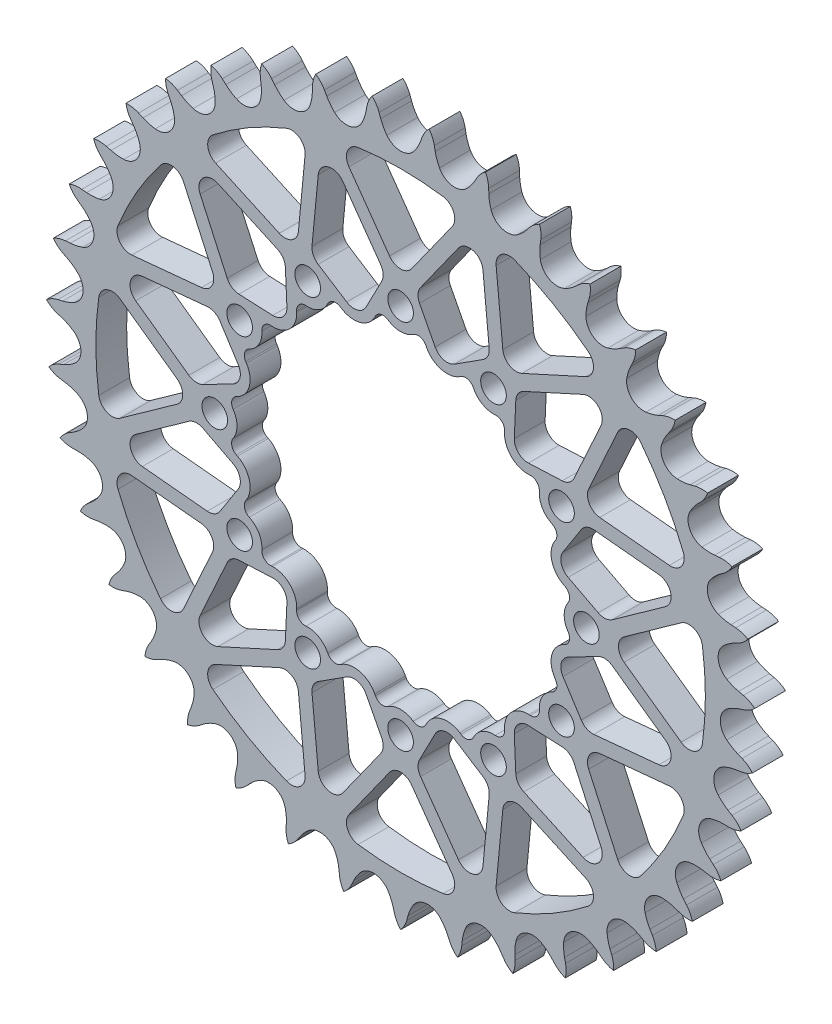
from build123d import *

# Parameters (mm, degrees)
EXTRUSION_DEPTH          = 7.2136
CUT_EXTRUDE_DEPTH        = 118.514389318
CUT_EXTRUDE_DEPTH_BACK   = 118.514389318
SKETCH1_R                = 35.764294032
F_6_0MM_DOWEL_HOLE1_D    = 6
CIRPATTERN1_COUNT        = 12
CUT_EXTRUDE2_DEPTH       = 118.514389318
FILLET2_R                = 3.175
CIRPATTERN3_COUNT        = 12
FILLET2_OF_CIRPATTERN3_R = 3.175
SKETCH14_R               = 35.764294032
CUT_EXTRUDE7_DEPTH       = 118.514389318


with BuildPart() as part:
    # Teeth Sketch → Extrusion (new body)
    with BuildSketch(Plane.XY):
        with BuildLine():
            ThreePointArc((6.676484762, 82.703103732), (5.710873677, 81.555589606), (5.037571935, 80.215493266))
            Line((5.037571935, 80.215493266), (4.65053543, 79.150636707))
            ThreePointArc((4.65053543, 79.150636707), (4.030589042, 77.787636082), (3.22092759, 76.5280518))
            ThreePointArc((3.22092759, 76.5280518), (0, 74.905926143), (-3.22092759, 76.5280518))
            ThreePointArc((-3.22092759, 76.5280518), (-4.030589042, 77.787636082), (-4.65053543, 79.150636707))
            Line((-4.65053543, 79.150636707), (-5.037571935, 80.215493266))
            ThreePointArc((-5.037571935, 80.215493266), (-5.710873677, 81.555589606), (-6.676484762, 82.703103732))
            ThreePointArc((-6.676484762, 82.703103732), (-7.445517227, 81.415554702), (-7.895133318, 79.984807062))
            Line((-7.895133318, 79.984807062), (-8.106342797, 78.871655094))
            ThreePointArc((-8.106342797, 78.871655094), (-8.499620367, 77.426858575), (-9.096745387, 76.053706749))
            ThreePointArc((-9.096745387, 76.053706749), (-12.015755556, 73.935914073), (-15.455180235, 75.020360508))
            ThreePointArc((-15.455180235, 75.020360508), (-16.456408311, 76.133754674), (-17.286967233, 77.379658404))
            Line((-17.286967233, 77.379658404), (-17.83980672, 78.368640329))
            ThreePointArc((-17.83980672, 78.368640329), (-18.719355953, 79.583377579), (-19.856536839, 80.561136787))
            ThreePointArc((-19.856536839, 80.561136787), (-20.409073146, 79.166899696), (-20.623358765, 77.682556369))
            Line((-20.623358765, 77.682556369), (-20.653271004, 76.549939044))
            ThreePointArc((-20.653271004, 76.549939044), (-20.809694072, 75.060766102), (-21.178817437, 73.609610642))
            ThreePointArc((-21.178817437, 73.609610642), (-23.720309356, 71.051000665), (-27.289151829, 71.569681286))
            ThreePointArc((-27.289151829, 71.569681286), (-28.456015249, 72.508049011), (-29.475675664, 73.604587595))
            Line((-29.475675664, 73.604587595), (-30.179999883, 74.492080773))
            ThreePointArc((-30.179999883, 74.492080773), (-31.243016742, 75.549997876), (-32.522315041, 76.332678717))
            ThreePointArc((-32.522315041, 76.332678717), (-32.844044791, 74.867863573), (-32.817450053, 73.368368272))
            Line((-32.817450053, 73.368368272), (-32.66529034, 72.245619783))
            ThreePointArc((-32.66529034, 72.245619783), (-32.580807632, 70.750639215), (-32.71236924, 69.259064285))
            ThreePointArc((-32.71236924, 69.259064285), (-34.810519602, 66.325903661), (-38.416348726, 66.265384911))
            ThreePointArc((-38.416348726, 66.265384911), (-39.71862634, 67.004422965), (-40.900979579, 67.923196629))
            Line((-40.900979579, 67.923196629), (-41.738546902, 68.686215454))
            ThreePointArc((-41.738546902, 68.686215454), (-42.957499809, 69.559912912), (-44.345782367, 70.127244363))
            ThreePointArc((-44.345782367, 70.127244363), (-44.428372928, 68.629789109), (-44.161586623, 67.153977974))
            Line((-44.161586623, 67.153977974), (-43.831295815, 66.070176918))
            ThreePointArc((-43.831295815, 66.070176918), (-43.508095388, 64.608107935), (-43.398687863, 63.114744543))
            ThreePointArc((-43.398687863, 63.114744543), (-44.999155676, 59.883000591), (-48.54858237, 59.244849876))
            ThreePointArc((-48.54858237, 59.244849876), (-49.952545871, 59.765417561), (-51.266969607, 60.48263055))
            Line((-51.266969607, 60.48263055), (-52.21608748, 61.101413234))
            ThreePointArc((-52.21608748, 61.101413234), (-53.559406195, 61.768262742), (-55.020717224, 62.105551216))
            ThreePointArc((-55.020717224, 62.105551216), (-54.862029543, 60.614239157), (-54.361961296, 59.200334922))
            Line((-54.361961296, 59.200334922), (-53.862093752, 58.183551176))
            ThreePointArc((-53.862093752, 58.183551176), (-53.308546327, 56.792260597), (-52.961003266, 55.335786069))
            ThreePointArc((-52.961003266, 55.335786069), (-54.022337255, 51.889159262), (-57.423433231, 50.689904348))
            ThreePointArc((-57.423433231, 50.689904348), (-58.892720703, 50.978519235), (-60.305172051, 51.475596109))
            Line((-60.305172051, 51.475596109), (-61.34125882, 51.934116506))
            ThreePointArc((-61.34125882, 51.934116506), (-62.774152094, 52.376847013), (-64.270644405, 52.475356916))
            ThreePointArc((-64.270644405, 52.475356916), (-63.87478841, 51.02881225), (-63.154389727, 49.713434291))
            Line((-63.154389727, 49.713434291), (-62.497891753, 48.790002021))
            ThreePointArc((-62.497891753, 48.790002021), (-61.728333918, 47.505523541), (-61.151656504, 46.123659804))
            ThreePointArc((-61.151656504, 46.123659804), (-61.646368676, 42.551415963), (-64.811047336, 40.822116924))
            ThreePointArc((-64.811047336, 40.822116924), (-66.307605004, 40.871304038), (-67.781502216, 41.135370767))
            Line((-67.781502216, 41.135370767), (-68.877723777, 41.42175344))
            ThreePointArc((-68.877723777, 41.42175344), (-70.363080428, 41.628898458), (-71.855995657, 41.486078435))
            ThreePointArc((-71.855995657, 41.486078435), (-71.23322381, 40.12176591), (-70.311152637, 38.938981826))
            Line((-70.311152637, 38.938981826), (-69.515027187, 38.132817442))
            ThreePointArc((-69.515027187, 38.132817442), (-68.549390085, 36.988418379), (-67.75851396, 35.716954977))
            ThreePointArc((-67.75851396, 35.716954977), (-67.673791529, 32.111613343), (-70.520089358, 29.897058114))
            ThreePointArc((-70.520089358, 29.897058114), (-72.005157166, 29.705543536), (-73.502327078, 29.729760931))
            Line((-73.502327078, 29.729760931), (-74.630291869, 29.836588719))
            ThreePointArc((-74.630291869, 29.836588719), (-76.129641939, 29.8027833), (-77.580314364, 29.422332315))
            ThreePointArc((-77.580314364, 29.422332315), (-76.74675613, 28.175586908), (-75.646893627, 27.156030185))
            Line((-75.646893627, 27.156030185), (-74.731759931, 26.488012922))
            ThreePointArc((-74.731759931, 26.488012922), (-73.595053056, 25.51333261), (-72.610461496, 24.385199777))
            ThreePointArc((-72.610461496, 24.385199777), (-71.948498729, 20.840136804), (-74.402698108, 18.197681204))
            ThreePointArc((-74.402698108, 18.197681204), (-75.837813579, 17.77042506), (-77.319480277, 17.554165902))
            Line((-77.319480277, 17.554165902), (-78.449974603, 17.478672021))
            ThreePointArc((-78.449974603, 17.478672021), (-79.924485713, 17.204791709), (-81.295343681, 16.596563242))
            ThreePointArc((-81.295343681, 16.596563242), (-80.27258778, 15.499675005), (-79.023419807, 14.669751627))
            Line((-79.023419807, 14.669751627), (-78.012979347, 14.15718278))
            ThreePointArc((-78.012979347, 14.15718278), (-76.734642811, 13.377464928), (-75.58183622, 12.421880712))
            ThreePointArc((-75.58183622, 12.421880712), (-74.359777605, 9.028911669), (-76.358316059, 6.026993909))
            ThreePointArc((-76.358316059, 6.026993909), (-77.706310456, 5.375061909), (-79.134099551, 4.923927198))
            Line((-79.134099551, 4.923927198), (-80.237844202, 4.6680669))
            ThreePointArc((-80.237844202, 4.6680669), (-81.649327289, 4.161205049), (-82.904866299, 3.340951899))
            ThreePointArc((-82.904866299, 3.340951899), (-81.719401571, 2.422329661), (-80.353280924, 1.803534207))
            Line((-80.353280924, 1.803534207), (-79.273703577, 1.45968904))
            ThreePointArc((-79.273703577, 1.45968904), (-77.886845624, 0.895127931), (-76.595681088, 0.136841462))
            ThreePointArc((-76.595681088, 0.136841462), (-74.8451773, -3.016157536), (-76.336293733, -6.299789363))
            ThreePointArc((-76.336293733, -6.299789363), (-77.56225471, -7.159512522), (-78.899187214, -7.833838635))
            Line((-78.899187214, -7.833838635), (-79.947595784, -8.263438702))
            ThreePointArc((-79.947595784, -8.263438702), (-81.259494176, -8.990154635), (-82.367196428, -10.001188343))
            ThreePointArc((-82.367196428, -10.001188343), (-81.049725787, -10.717752749), (-79.602034272, -11.109393802))
            Line((-79.602034272, -11.109393802), (-78.481280524, -11.275609878))
            ThreePointArc((-78.481280524, -11.275609878), (-77.021820047, -11.610392409), (-75.625738049, -12.151741911))
            ThreePointArc((-75.625738049, -12.151741911), (-73.392126218, -14.983109845), (-74.337201497, -18.463411399))
            ThreePointArc((-74.337201497, -18.463411399), (-75.409377308, -19.50865934), (-76.620827372, -20.388712162))
            Line((-76.620827372, -20.388712162), (-77.586746629, -20.980925582))
            ThreePointArc((-77.586746629, -20.980925582), (-78.765082849, -21.908674036), (-79.696259435, -23.08430306))
            ThreePointArc((-79.696259435, -23.08430306), (-78.280904679, -23.580250992), (-76.789136745, -23.734594346))
            Line((-76.789136745, -23.734594346), (-75.656233531, -23.718876424))
            ThreePointArc((-75.656233531, -23.718876424), (-74.161969788, -23.815209685), (-72.697128119, -24.125601551))
            ThreePointArc((-72.697128119, -24.125601551), (-70.038257617, -26.562007479), (-70.41281479, -30.148840778))
            ThreePointArc((-70.41281479, -30.148840778), (-71.303436645, -31.352542128), (-72.358028349, -32.415528753))
            Line((-72.358028349, -32.415528753), (-73.216441492, -33.155017511))
            ThreePointArc((-73.216441492, -33.155017511), (-74.230697248, -34.259770288), (-74.961231185, -35.569546454))
            ThreePointArc((-74.961231185, -35.569546454), (-73.484649258, -35.832033121), (-71.987440912, -35.745081364))
            Line((-71.987440912, -35.745081364), (-70.871729829, -35.547836529))
            ThreePointArc((-70.871729829, -35.547836529), (-69.381363468, -35.403225539), (-67.885700756, -35.474620783))
            ThreePointArc((-67.885700756, -35.474620783), (-64.870434934, -37.452963072), (-64.664773166, -41.053431017))
            ThreePointArc((-64.664773166, -41.053431017), (-65.350774426, -42.384410543), (-66.221194398, -43.602800177))
            Line((-66.221194398, -43.602800177), (-66.949868978, -44.470411902))
            ThreePointArc((-66.949868978, -44.470411902), (-67.773775581, -45.723556485), (-68.284746423, -47.133557278))
            ThreePointArc((-68.284746423, -47.133557278), (-66.785180021, -47.155784414), (-65.321308173, -46.829789551))
            Line((-65.321308173, -46.829789551), (-64.251685552, -46.456126341))
            ThreePointArc((-64.251685552, -46.456126341), (-62.803816278, -46.074316448), (-61.316069403, -45.904865971))
            ThreePointArc((-61.316069403, -45.904865971), (-58.022502061, -47.373906594), (-57.241947884, -50.894758957))
            ThreePointArc((-57.241947884, -50.894758957), (-57.705561477, -52.318544989), (-58.369266298, -53.66078198))
            Line((-58.369266298, -53.66078198), (-58.949330025, -54.634045983))
            ThreePointArc((-58.949330025, -54.634045983), (-59.561548726, -56.003126587), (-59.839722596, -57.476833727))
            ThreePointArc((-59.839722596, -57.476833727), (-58.356009703, -57.25822566), (-56.963387864, -56.701630787))
            Line((-56.963387864, -56.701630787), (-55.967556369, -56.161226883))
            ThreePointArc((-55.967556369, -56.161226883), (-54.599683236, -55.552106762), (-53.15838406, -55.146199243))
            ThreePointArc((-53.15838406, -55.146199243), (-49.671816862, -56.06789082), (-48.336586219, -59.417939375))
            ThreePointArc((-48.336586219, -59.417939375), (-48.565804798, -60.897656602), (-49.00560486, -62.328977716))
            Line((-49.00560486, -62.328977716), (-49.422034389, -63.382686971))
            ThreePointArc((-49.422034389, -63.382686971), (-49.806709045, -64.832245127), (-49.844881387, -66.331490374))
            ThreePointArc((-49.844881387, -66.331490374), (-48.415449386, -65.877708938), (-47.130145731, -65.104929569))
            Line((-47.130145731, -65.104929569), (-46.233896874, -64.411781148))
            ThreePointArc((-46.233896874, -64.411781148), (-44.981447078, -63.591126692), (-43.623924493, -62.959274922))
            ThreePointArc((-43.623924493, -62.959274922), (-40.034657698, -63.309746125), (-38.179332362, -66.402226373))
            ThreePointArc((-38.179332362, -66.402226373), (-38.168219284, -67.899550896), (-38.372723998, -69.38288567))
            Line((-38.372723998, -69.38288567), (-38.614734022, -70.489749661))
            ThreePointArc((-38.614734022, -70.489749661), (-38.761901763, -71.982242573), (-38.559083932, -73.468196262))
            ThreePointArc((-38.559083932, -73.468196262), (-37.220954361, -72.790994159), (-36.076257579, -71.822044874))
            Line((-36.076257579, -71.822044874), (-35.302803736, -70.994104116))
            ThreePointArc((-35.302803736, -70.994104116), (-34.198215068, -69.983169844), (-32.959628196, -69.141738451))
            ThreePointArc((-32.959628196, -69.141738451), (-29.360621929, -68.91191226), (-27.033253851, -71.666730588))
            ThreePointArc((-27.033253851, -71.666730588), (-26.78209694, -73.142882488), (-26.74600974, -74.639813329))
            Line((-26.74600974, -74.639813329), (-26.807332328, -75.77116486))
            ThreePointArc((-26.807332328, -75.77116486), (-26.713181585, -77.267937748), (-26.274626458, -78.702114459))
            ThreePointArc((-26.274626458, -78.702114459), (-25.06245617, -77.819030866), (-24.088013307, -76.679006943))
            Line((-24.088013307, -76.679006943), (-23.457386525, -75.737717079))
            ThreePointArc((-23.457386525, -75.737717079), (-22.529267252, -74.562685657), (-21.441694841, -73.533467273))
            ThreePointArc((-21.441694841, -73.533467273), (-17.926161474, -72.729296065), (-15.187028265, -75.075104125))
            ThreePointArc((-15.187028265, -75.075104125), (-14.702332353, -76.491851845), (-14.426587879, -77.96360903))
            Line((-14.426587879, -77.96360903), (-14.305634807, -79.090146691))
            ThreePointArc((-14.305634807, -79.090146691), (-13.972604036, -80.552433921), (-13.309669959, -81.897689231))
            ThreePointArc((-13.309669959, -81.897689231), (-12.254853529, -80.83159555), (-11.475902142, -79.55002301))
            Line((-11.475902142, -79.55002301), (-11.004435324, -78.519762952))
            ThreePointArc((-11.004435324, -78.519762952), (-10.276823247, -77.211067077), (-9.368432854, -76.020717918))
            ThreePointArc((-9.368432854, -76.020717918), (-6.027422853, -74.663029306), (-2.947466624, -76.5390719))
            ThreePointArc((-2.947466624, -76.5390719), (-2.241785081, -77.859722417), (-1.733524971, -79.26818821))
            Line((-1.733524971, -79.26818821), (-1.43342886, -80.360735266))
            ThreePointArc((-1.43342886, -80.360735266), (-0.870143382, -81.750664368), (0, -82.97215687))
            ThreePointArc((0, -82.97215687), (0.870143382, -81.750664368), (1.43342886, -80.360735266))
            Line((1.43342886, -80.360735266), (1.733524971, -79.26818821))
            ThreePointArc((1.733524971, -79.26818821), (2.241785081, -77.859722417), (2.947466624, -76.5390719))
            ThreePointArc((2.947466624, -76.5390719), (6.027422853, -74.663029306), (9.368432854, -76.020717918))
            ThreePointArc((9.368432854, -76.020717918), (10.276823247, -77.211067077), (11.004435324, -78.519762952))
            Line((11.004435324, -78.519762952), (11.475902142, -79.55002301))
            ThreePointArc((11.475902142, -79.55002301), (12.254853529, -80.83159555), (13.309669959, -81.897689231))
            ThreePointArc((13.309669959, -81.897689231), (13.972604036, -80.552433921), (14.305634807, -79.090146691))
            Line((14.305634807, -79.090146691), (14.426587879, -77.96360903))
            ThreePointArc((14.426587879, -77.96360903), (14.702332353, -76.491851845), (15.187028265, -75.075104125))
            ThreePointArc((15.187028265, -75.075104125), (17.926161474, -72.729296065), (21.441694841, -73.533467273))
            ThreePointArc((21.441694841, -73.533467273), (22.529267252, -74.562685657), (23.457386525, -75.737717079))
            Line((23.457386525, -75.737717079), (24.088013307, -76.679006943))
            ThreePointArc((24.088013307, -76.679006943), (25.06245617, -77.819030866), (26.274626458, -78.702114459))
            ThreePointArc((26.274626458, -78.702114459), (26.713181585, -77.267937748), (26.807332328, -75.77116486))
            Line((26.807332328, -75.77116486), (26.74600974, -74.639813329))
            ThreePointArc((26.74600974, -74.639813329), (26.78209694, -73.142882488), (27.033253851, -71.666730588))
            ThreePointArc((27.033253851, -71.666730588), (29.360621929, -68.91191226), (32.959628196, -69.141738451))
            ThreePointArc((32.959628196, -69.141738451), (34.198215068, -69.983169844), (35.302803736, -70.994104116))
            Line((35.302803736, -70.994104116), (36.076257579, -71.822044874))
            ThreePointArc((36.076257579, -71.822044874), (37.220954361, -72.790994159), (38.559083932, -73.468196262))
            ThreePointArc((38.559083932, -73.468196262), (38.761901763, -71.982242573), (38.614734022, -70.489749661))
            Line((38.614734022, -70.489749661), (38.372723998, -69.38288567))
            ThreePointArc((38.372723998, -69.38288567), (38.168219284, -67.899550896), (38.179332362, -66.402226373))
            ThreePointArc((38.179332362, -66.402226373), (40.034657698, -63.309746125), (43.623924493, -62.959274922))
            ThreePointArc((43.623924493, -62.959274922), (44.981447078, -63.591126692), (46.233896874, -64.411781148))
            Line((46.233896874, -64.411781148), (47.130145731, -65.104929569))
            ThreePointArc((47.130145731, -65.104929569), (48.415449386, -65.877708938), (49.844881387, -66.331490374))
            ThreePointArc((49.844881387, -66.331490374), (49.806709045, -64.832245127), (49.422034389, -63.382686971))
            Line((49.422034389, -63.382686971), (49.00560486, -62.328977716))
            ThreePointArc((49.00560486, -62.328977716), (48.565804798, -60.897656602), (48.336586219, -59.417939375))
            ThreePointArc((48.336586219, -59.417939375), (49.671816862, -56.06789082), (53.15838406, -55.146199243))
            ThreePointArc((53.15838406, -55.146199243), (54.599683236, -55.552106762), (55.967556369, -56.161226883))
            Line((55.967556369, -56.161226883), (56.963387864, -56.701630787))
            ThreePointArc((56.963387864, -56.701630787), (58.356009703, -57.25822566), (59.839722596, -57.476833727))
            ThreePointArc((59.839722596, -57.476833727), (59.561548726, -56.003126587), (58.949330025, -54.634045983))
            Line((58.949330025, -54.634045983), (58.369266298, -53.66078198))
            ThreePointArc((58.369266298, -53.66078198), (57.705561477, -52.318544989), (57.241947884, -50.894758957))
            ThreePointArc((57.241947884, -50.894758957), (58.022502061, -47.373906594), (61.316069403, -45.904865971))
            ThreePointArc((61.316069403, -45.904865971), (62.803816278, -46.074316448), (64.251685552, -46.456126341))
            Line((64.251685552, -46.456126341), (65.321308173, -46.829789551))
            ThreePointArc((65.321308173, -46.829789551), (66.785180021, -47.155784414), (68.284746423, -47.133557278))
            ThreePointArc((68.284746423, -47.133557278), (67.773775581, -45.723556485), (66.949868978, -44.470411902))
            Line((66.949868978, -44.470411902), (66.221194398, -43.602800177))
            ThreePointArc((66.221194398, -43.602800177), (65.350774426, -42.384410543), (64.664773166, -41.053431017))
            ThreePointArc((64.664773166, -41.053431017), (64.870434934, -37.452963072), (67.885700756, -35.474620783))
            ThreePointArc((67.885700756, -35.474620783), (69.381363468, -35.403225539), (70.871729829, -35.547836529))
            Line((70.871729829, -35.547836529), (71.987440912, -35.745081364))
            ThreePointArc((71.987440912, -35.745081364), (73.484649258, -35.832033121), (74.961231185, -35.569546454))
            ThreePointArc((74.961231185, -35.569546454), (74.230697248, -34.259770288), (73.216441492, -33.155017511))
            Line((73.216441492, -33.155017511), (72.358028349, -32.415528753))
            ThreePointArc((72.358028349, -32.415528753), (71.303436645, -31.352542128), (70.41281479, -30.148840778))
            ThreePointArc((70.41281479, -30.148840778), (70.038257617, -26.562007479), (72.697128119, -24.125601551))
            ThreePointArc((72.697128119, -24.125601551), (74.161969788, -23.815209685), (75.656233531, -23.718876424))
            Line((75.656233531, -23.718876424), (76.789136745, -23.734594346))
            ThreePointArc((76.789136745, -23.734594346), (78.280904679, -23.580250992), (79.696259435, -23.08430306))
            ThreePointArc((79.696259435, -23.08430306), (78.765082849, -21.908674036), (77.586746629, -20.980925582))
            Line((77.586746629, -20.980925582), (76.620827372, -20.388712162))
            ThreePointArc((76.620827372, -20.388712162), (75.409377308, -19.50865934), (74.337201497, -18.463411399))
            ThreePointArc((74.337201497, -18.463411399), (73.392126218, -14.983109845), (75.625738049, -12.151741911))
            ThreePointArc((75.625738049, -12.151741911), (77.021820047, -11.610392409), (78.481280524, -11.275609878))
            Line((78.481280524, -11.275609878), (79.602034272, -11.109393802))
            ThreePointArc((79.602034272, -11.109393802), (81.049725787, -10.717752749), (82.367196428, -10.001188343))
            ThreePointArc((82.367196428, -10.001188343), (81.259494176, -8.990154635), (79.947595784, -8.263438702))
            Line((79.947595784, -8.263438702), (78.899187214, -7.833838635))
            ThreePointArc((78.899187214, -7.833838635), (77.56225471, -7.159512522), (76.336293733, -6.299789363))
            ThreePointArc((76.336293733, -6.299789363), (74.8451773, -3.016157536), (76.595681088, 0.136841462))
            ThreePointArc((76.595681088, 0.136841462), (77.886845624, 0.895127931), (79.273703577, 1.45968904))
            Line((79.273703577, 1.45968904), (80.353280924, 1.803534207))
            ThreePointArc((80.353280924, 1.803534207), (81.719401571, 2.422329661), (82.904866299, 3.340951899))
            ThreePointArc((82.904866299, 3.340951899), (81.649327289, 4.161205049), (80.237844202, 4.6680669))
            Line((80.237844202, 4.6680669), (79.134099551, 4.923927198))
            ThreePointArc((79.134099551, 4.923927198), (77.706310456, 5.375061909), (76.358316059, 6.026993909))
            ThreePointArc((76.358316059, 6.026993909), (74.359777605, 9.028911669), (75.58183622, 12.421880712))
            ThreePointArc((75.58183622, 12.421880712), (76.734642811, 13.377464928), (78.012979347, 14.15718278))
            Line((78.012979347, 14.15718278), (79.023419807, 14.669751627))
            ThreePointArc((79.023419807, 14.669751627), (80.27258778, 15.499675005), (81.295343681, 16.596563242))
            ThreePointArc((81.295343681, 16.596563242), (79.924485713, 17.204791709), (78.449974603, 17.478672021))
            Line((78.449974603, 17.478672021), (77.319480277, 17.554165902))
            ThreePointArc((77.319480277, 17.554165902), (75.837813579, 17.77042506), (74.402698108, 18.197681204))
            ThreePointArc((74.402698108, 18.197681204), (71.948498729, 20.840136804), (72.610461496, 24.385199777))
            ThreePointArc((72.610461496, 24.385199777), (73.595053056, 25.51333261), (74.731759931, 26.488012922))
            Line((74.731759931, 26.488012922), (75.646893627, 27.156030185))
            ThreePointArc((75.646893627, 27.156030185), (76.74675613, 28.175586908), (77.580314364, 29.422332315))
            ThreePointArc((77.580314364, 29.422332315), (76.129641939, 29.8027833), (74.630291869, 29.836588719))
            Line((74.630291869, 29.836588719), (73.502327078, 29.729760931))
            ThreePointArc((73.502327078, 29.729760931), (72.005157166, 29.705543536), (70.520089358, 29.897058114))
            ThreePointArc((70.520089358, 29.897058114), (67.673791529, 32.111613343), (67.75851396, 35.716954977))
            ThreePointArc((67.75851396, 35.716954977), (68.549390085, 36.988418379), (69.515027187, 38.132817442))
            Line((69.515027187, 38.132817442), (70.311152637, 38.938981826))
            ThreePointArc((70.311152637, 38.938981826), (71.23322381, 40.12176591), (71.855995657, 41.486078435))
            ThreePointArc((71.855995657, 41.486078435), (70.363080428, 41.628898458), (68.877723777, 41.42175344))
            Line((68.877723777, 41.42175344), (67.781502216, 41.135370767))
            ThreePointArc((67.781502216, 41.135370767), (66.307605004, 40.871304038), (64.811047336, 40.822116924))
            ThreePointArc((64.811047336, 40.822116924), (61.646368676, 42.551415963), (61.151656504, 46.123659804))
            ThreePointArc((61.151656504, 46.123659804), (61.728333918, 47.505523541), (62.497891753, 48.790002021))
            Line((62.497891753, 48.790002021), (63.154389727, 49.713434291))
            ThreePointArc((63.154389727, 49.713434291), (63.87478841, 51.02881225), (64.270644405, 52.475356916))
            ThreePointArc((64.270644405, 52.475356916), (62.774152094, 52.376847013), (61.34125882, 51.934116506))
            Line((61.34125882, 51.934116506), (60.305172051, 51.475596109))
            ThreePointArc((60.305172051, 51.475596109), (58.892720703, 50.978519235), (57.423433231, 50.689904348))
            ThreePointArc((57.423433231, 50.689904348), (54.022337255, 51.889159262), (52.961003266, 55.335786069))
            ThreePointArc((52.961003266, 55.335786069), (53.308546327, 56.792260597), (53.862093752, 58.183551176))
            Line((53.862093752, 58.183551176), (54.361961296, 59.200334922))
            ThreePointArc((54.361961296, 59.200334922), (54.862029543, 60.614239157), (55.020717224, 62.105551216))
            ThreePointArc((55.020717224, 62.105551216), (53.559406195, 61.768262742), (52.21608748, 61.101413234))
            Line((52.21608748, 61.101413234), (51.266969607, 60.48263055))
            ThreePointArc((51.266969607, 60.48263055), (49.952545871, 59.765417561), (48.54858237, 59.244849876))
            ThreePointArc((48.54858237, 59.244849876), (44.999155676, 59.883000591), (43.398687863, 63.114744543))
            ThreePointArc((43.398687863, 63.114744543), (43.508095388, 64.608107935), (43.831295815, 66.070176918))
            Line((43.831295815, 66.070176918), (44.161586623, 67.153977974))
            ThreePointArc((44.161586623, 67.153977974), (44.428372928, 68.629789109), (44.345782367, 70.127244363))
            ThreePointArc((44.345782367, 70.127244363), (42.957499809, 69.559912912), (41.738546902, 68.686215454))
            Line((41.738546902, 68.686215454), (40.900979579, 67.923196629))
            ThreePointArc((40.900979579, 67.923196629), (39.71862634, 67.004422965), (38.416348726, 66.265384911))
            ThreePointArc((38.416348726, 66.265384911), (34.810519602, 66.325903661), (32.71236924, 69.259064285))
            ThreePointArc((32.71236924, 69.259064285), (32.580807632, 70.750639215), (32.66529034, 72.245619783))
            Line((32.66529034, 72.245619783), (32.817450053, 73.368368272))
            ThreePointArc((32.817450053, 73.368368272), (32.844044791, 74.867863573), (32.522315041, 76.332678717))
            ThreePointArc((32.522315041, 76.332678717), (31.243016742, 75.549997876), (30.179999883, 74.492080773))
            Line((30.179999883, 74.492080773), (29.475675664, 73.604587595))
            ThreePointArc((29.475675664, 73.604587595), (28.456015249, 72.508049011), (27.289151829, 71.569681286))
            ThreePointArc((27.289151829, 71.569681286), (23.720309356, 71.051000665), (21.178817437, 73.609610642))
            ThreePointArc((21.178817437, 73.609610642), (20.809694072, 75.060766102), (20.653271004, 76.549939044))
            Line((20.653271004, 76.549939044), (20.623358765, 77.682556369))
            ThreePointArc((20.623358765, 77.682556369), (20.409073146, 79.166899696), (19.856536839, 80.561136787))
            ThreePointArc((19.856536839, 80.561136787), (18.719355953, 79.583377579), (17.83980672, 78.368640329))
            Line((17.83980672, 78.368640329), (17.286967233, 77.379658404))
            ThreePointArc((17.286967233, 77.379658404), (16.456408311, 76.133754674), (15.455180235, 75.020360508))
            ThreePointArc((15.455180235, 75.020360508), (12.015755556, 73.935914073), (9.096745387, 76.053706749))
            ThreePointArc((9.096745387, 76.053706749), (8.499620367, 77.426858575), (8.106342797, 78.871655094))
            Line((8.106342797, 78.871655094), (7.895133318, 79.984807062))
            ThreePointArc((7.895133318, 79.984807062), (7.445517227, 81.415554702), (6.676484762, 82.703103732))
        make_face()
    extrude(amount=EXTRUSION_DEPTH)

    # Sketch1 → Cut-Extrude (cut, two sides: drawn at the far end of the back side and taken through both)
    with BuildSketch(Plane(origin=(0, 0, 0), x_dir=(-1, 0, 0), z_dir=(0, 0, -1)).offset(-CUT_EXTRUDE_DEPTH_BACK)):
        Circle(SKETCH1_R)
    extrude(amount=CUT_EXTRUDE_DEPTH + CUT_EXTRUDE_DEPTH_BACK, mode=Mode.SUBTRACT)

    # Ø6.0mm Dowel Hole1 (through all)
    with Locations(Plane.XY.offset(7.2136)):
        with Locations((-43.500000122, 0)):
            f_6_0mm_dowel_hole1 = Hole(F_6_0MM_DOWEL_HOLE1_D / 2)

    # CirPattern1: Ø6.0mm Dowel Hole1 ×12 about axis
    cirpattern1_axis = Axis((0, 0, 7.2136), (0, 0, -1))
    for i in range(1, CIRPATTERN1_COUNT):
        add(f_6_0mm_dowel_hole1.rotate(cirpattern1_axis, i * 360 / CIRPATTERN1_COUNT), mode=Mode.SUBTRACT)

    # Sketch9 → Cut-Extrude2 (cut, through all)
    with BuildSketch(Plane.XY):
        with BuildLine():
            Line((-48.707000122, 0), (-69.753908506, 15.006805414))
            ThreePointArc((-69.753908506, 15.006805414), (-71.349926143, 0), (-69.753908506, -15.006805414))
            Line((-69.753908506, -15.006805414), (-48.707000122, 0))
        make_face()
        Polygon((-43.325238517, 20.926367996), (-68.918736366, 18.466719753), (-47.983941179, 3.539852965), (-36.140398804, 9.683790674), align=None)
    cut_extrude2 = extrude(amount=CUT_EXTRUDE2_DEPTH, mode=Mode.SUBTRACT)

    # Fillet2
    fillet2_edges = [part.edges().sort_by_distance(p)[0] for p in [
        (-68.918736366, 18.466719753, 3.6068),
        (-36.140398804, 9.683790674, 3.6068),
        (-47.983941179, 3.539852965, 3.6068),
        (-43.325238517, 20.926367996, 3.6068),
        (-69.753908506, -15.006805414, 3.6068),
        (-48.707000122, 0, 3.6068),
        (-69.753908506, 15.006805414, 3.6068),
    ]]
    fillet(fillet2_edges, radius=FILLET2_R)

    # CirPattern3: Cut-Extrude2 ×12 about axis
    cirpattern3_axis = Axis((0, 0, 7.2136), (0, 0, -1))
    for i in range(1, CIRPATTERN3_COUNT):
        add(cut_extrude2.rotate(cirpattern3_axis, i * 360 / CIRPATTERN3_COUNT), mode=Mode.SUBTRACT)

    # Fillet2 of CirPattern3
    fillet2_of_cirpattern3_edges = [part.edges().sort_by_distance(p)[0] for p in [
        (-50.452016613, 50.452016613, 3.6068),
        (-26.45660813, 26.45660813, 3.6068),
        (-39.785385552, 27.057573183, 3.6068),
        (-27.057573183, 39.785385552, 3.6068),
        (-67.912059487, 21.880679535, 3.6068),
        (-42.181499448, 24.353500061, 3.6068),
        (-52.905254073, 47.873228971, 3.6068),
        (-18.466719753, 68.918736366, 3.6068),
        (-9.683790674, 36.140398804, 3.6068),
        (-20.926367996, 43.325238517, 3.6068),
        (-3.539852965, 47.983941179, 3.6068),
        (-47.873228971, 52.905254073, 3.6068),
        (-24.353500061, 42.181499448, 3.6068),
        (-21.880679535, 67.912059487, 3.6068),
        (18.466719753, 68.918736366, 3.6068),
        (9.683790674, 36.140398804, 3.6068),
        (3.539852965, 47.983941179, 3.6068),
        (20.926367996, 43.325238517, 3.6068),
        (-15.006805414, 69.753908506, 3.6068),
        (0, 48.707000122, 3.6068),
        (15.006805414, 69.753908506, 3.6068),
        (50.452016613, 50.452016613, 3.6068),
        (26.45660813, 26.45660813, 3.6068),
        (27.057573183, 39.785385552, 3.6068),
        (39.785385552, 27.057573183, 3.6068),
        (21.880679535, 67.912059487, 3.6068),
        (24.353500061, 42.181499448, 3.6068),
        (47.873228971, 52.905254073, 3.6068),
        (68.918736366, 18.466719753, 3.6068),
        (36.140398804, 9.683790674, 3.6068),
        (43.325238517, 20.926367996, 3.6068),
        (47.983941179, 3.539852965, 3.6068),
        (52.905254073, 47.873228971, 3.6068),
        (42.181499448, 24.353500061, 3.6068),
        (67.912059487, 21.880679535, 3.6068),
        (68.918736366, -18.466719753, 3.6068),
        (36.140398804, -9.683790674, 3.6068),
        (47.983941179, -3.539852965, 3.6068),
        (43.325238517, -20.926367996, 3.6068),
        (69.753908506, 15.006805414, 3.6068),
        (48.707000122, 0, 3.6068),
        (69.753908506, -15.006805414, 3.6068),
        (50.452016613, -50.452016613, 3.6068),
        (26.45660813, -26.45660813, 3.6068),
        (39.785385552, -27.057573183, 3.6068),
        (27.057573183, -39.785385552, 3.6068),
        (67.912059487, -21.880679535, 3.6068),
        (42.181499448, -24.353500061, 3.6068),
        (52.905254073, -47.873228971, 3.6068),
        (18.466719753, -68.918736366, 3.6068),
        (9.683790674, -36.140398804, 3.6068),
        (20.926367996, -43.325238517, 3.6068),
        (3.539852965, -47.983941179, 3.6068),
        (47.873228971, -52.905254073, 3.6068),
        (24.353500061, -42.181499448, 3.6068),
        (21.880679535, -67.912059487, 3.6068),
        (-18.466719753, -68.918736366, 3.6068),
        (-9.683790674, -36.140398804, 3.6068),
        (-3.539852965, -47.983941179, 3.6068),
        (-20.926367996, -43.325238517, 3.6068),
        (15.006805414, -69.753908506, 3.6068),
        (0, -48.707000122, 3.6068),
        (-15.006805414, -69.753908506, 3.6068),
        (-50.452016613, -50.452016613, 3.6068),
        (-26.45660813, -26.45660813, 3.6068),
        (-27.057573183, -39.785385552, 3.6068),
        (-39.785385552, -27.057573183, 3.6068),
        (-21.880679535, -67.912059487, 3.6068),
        (-24.353500061, -42.181499448, 3.6068),
        (-47.873228971, -52.905254073, 3.6068),
        (-68.918736366, -18.466719753, 3.6068),
        (-36.140398804, -9.683790674, 3.6068),
        (-43.325238517, -20.926367996, 3.6068),
        (-47.983941179, -3.539852965, 3.6068),
        (-52.905254073, -47.873228971, 3.6068),
        (-42.181499448, -24.353500061, 3.6068),
        (-67.912059487, -21.880679535, 3.6068),
    ]]
    fillet(fillet2_of_cirpattern3_edges, radius=FILLET2_OF_CIRPATTERN3_R)

    # Sketch14 → Cut-Extrude7 (cut, through all)
    with BuildSketch(Plane.XY.offset(7.2136)):
        with BuildLine():
            Line((-38.172220048, 6.054477568), (-38.467891767, 5.901095365))
            ThreePointArc((-38.467891767, 5.901095365), (-39.503358435, 4.590816429), (-39.207362059, 2.947220294))
            ThreePointArc((-39.207362059, 2.947220294), (-38.293000122, 0), (-39.207362059, -2.947220294))
            ThreePointArc((-39.207362059, -2.947220294), (-39.503358435, -4.590816429), (-38.467891767, -5.901095365))
            Line((-38.467891767, -5.901095365), (-38.172220048, -6.054477568))
            ThreePointArc((-38.172220048, -6.054477568), (-35.412007742, -9.488618877), (-36.085351064, -13.842778644))
            Line((-36.085351064, -13.842778644), (-36.264719182, -14.123447388))
            ThreePointArc((-36.264719182, -14.123447388), (-36.506320154, -15.775915566), (-35.428181706, -17.051313384))
            ThreePointArc((-35.428181706, -17.051313384), (-33.162710893, -19.146500061), (-32.480961412, -22.156048675))
            ThreePointArc((-32.480961412, -22.156048675), (-31.915503725, -23.727442869), (-30.363623818, -24.344444379))
            Line((-30.363623818, -24.344444379), (-30.030873497, -24.329441404))
            ThreePointArc((-30.030873497, -24.329441404), (-25.923388865, -25.923388865), (-24.329441404, -30.030873497))
            Line((-24.329441404, -30.030873497), (-24.344444379, -30.363623818))
            ThreePointArc((-24.344444379, -30.363623818), (-23.727442869, -31.915503725), (-22.156048675, -32.480961412))
            ThreePointArc((-22.156048675, -32.480961412), (-19.146500061, -33.162710893), (-17.051313384, -35.428181706))
            ThreePointArc((-17.051313384, -35.428181706), (-15.775915566, -36.506320154), (-14.123447388, -36.264719182))
            Line((-14.123447388, -36.264719182), (-13.842778644, -36.085351064))
            ThreePointArc((-13.842778644, -36.085351064), (-9.488618877, -35.412007742), (-6.054477568, -38.172220048))
            Line((-6.054477568, -38.172220048), (-5.901095365, -38.467891767))
            ThreePointArc((-5.901095365, -38.467891767), (-4.590816429, -39.503358435), (-2.947220294, -39.207362059))
            ThreePointArc((-2.947220294, -39.207362059), (0, -38.293000122), (2.947220294, -39.207362059))
            ThreePointArc((2.947220294, -39.207362059), (4.590816429, -39.503358435), (5.901095365, -38.467891767))
            Line((5.901095365, -38.467891767), (6.054477568, -38.172220048))
            ThreePointArc((6.054477568, -38.172220048), (9.488618877, -35.412007742), (13.842778644, -36.085351064))
            Line((13.842778644, -36.085351064), (14.123447388, -36.264719182))
            ThreePointArc((14.123447388, -36.264719182), (15.775915566, -36.506320154), (17.051313384, -35.428181706))
            ThreePointArc((17.051313384, -35.428181706), (19.146500061, -33.162710893), (22.156048675, -32.480961412))
            ThreePointArc((22.156048675, -32.480961412), (23.727442869, -31.915503725), (24.344444379, -30.363623818))
            Line((24.344444379, -30.363623818), (24.329441404, -30.030873497))
            ThreePointArc((24.329441404, -30.030873497), (25.923388865, -25.923388865), (30.030873497, -24.329441404))
            Line((30.030873497, -24.329441404), (30.363623818, -24.344444379))
            ThreePointArc((30.363623818, -24.344444379), (31.915503725, -23.727442869), (32.480961412, -22.156048675))
            ThreePointArc((32.480961412, -22.156048675), (33.162710893, -19.146500061), (35.428181706, -17.051313384))
            ThreePointArc((35.428181706, -17.051313384), (36.506320154, -15.775915566), (36.264719182, -14.123447388))
            Line((36.264719182, -14.123447388), (36.085351064, -13.842778644))
            ThreePointArc((36.085351064, -13.842778644), (35.412007742, -9.488618877), (38.172220048, -6.054477568))
            Line((38.172220048, -6.054477568), (38.467891767, -5.901095365))
            ThreePointArc((38.467891767, -5.901095365), (39.503358435, -4.590816429), (39.207362059, -2.947220294))
            ThreePointArc((39.207362059, -2.947220294), (38.293000122, 0), (39.207362059, 2.947220294))
            ThreePointArc((39.207362059, 2.947220294), (39.503358435, 4.590816429), (38.467891767, 5.901095365))
            Line((38.467891767, 5.901095365), (38.172220048, 6.054477568))
            ThreePointArc((38.172220048, 6.054477568), (35.412007742, 9.488618877), (36.085351064, 13.842778644))
            Line((36.085351064, 13.842778644), (36.264719182, 14.123447388))
            ThreePointArc((36.264719182, 14.123447388), (36.506320154, 15.775915566), (35.428181706, 17.051313384))
            ThreePointArc((35.428181706, 17.051313384), (33.162710893, 19.146500061), (32.480961412, 22.156048675))
            ThreePointArc((32.480961412, 22.156048675), (31.915503725, 23.727442869), (30.363623818, 24.344444379))
            Line((30.363623818, 24.344444379), (30.030873497, 24.329441404))
            ThreePointArc((30.030873497, 24.329441404), (25.923388865, 25.923388865), (24.329441404, 30.030873497))
            Line((24.329441404, 30.030873497), (24.344444379, 30.363623818))
            ThreePointArc((24.344444379, 30.363623818), (23.727442869, 31.915503725), (22.156048675, 32.480961412))
            ThreePointArc((22.156048675, 32.480961412), (19.146500061, 33.162710893), (17.051313384, 35.428181706))
            ThreePointArc((17.051313384, 35.428181706), (15.775915566, 36.506320154), (14.123447388, 36.264719182))
            Line((14.123447388, 36.264719182), (13.842778644, 36.085351064))
            ThreePointArc((13.842778644, 36.085351064), (9.488618877, 35.412007742), (6.054477568, 38.172220048))
            Line((6.054477568, 38.172220048), (5.901095365, 38.467891767))
            ThreePointArc((5.901095365, 38.467891767), (4.590816429, 39.503358435), (2.947220294, 39.207362059))
            ThreePointArc((2.947220294, 39.207362059), (0, 38.293000122), (-2.947220294, 39.207362059))
            ThreePointArc((-2.947220294, 39.207362059), (-4.590816429, 39.503358435), (-5.901095365, 38.467891767))
            Line((-5.901095365, 38.467891767), (-6.054477568, 38.172220048))
            ThreePointArc((-6.054477568, 38.172220048), (-9.488618877, 35.412007742), (-13.842778644, 36.085351064))
            Line((-13.842778644, 36.085351064), (-14.123447388, 36.264719182))
            ThreePointArc((-14.123447388, 36.264719182), (-15.775915566, 36.506320154), (-17.051313384, 35.428181706))
            ThreePointArc((-17.051313384, 35.428181706), (-19.146500061, 33.162710893), (-22.156048675, 32.480961412))
            ThreePointArc((-22.156048675, 32.480961412), (-23.727442869, 31.915503725), (-24.344444379, 30.363623818))
            Line((-24.344444379, 30.363623818), (-24.329441404, 30.030873497))
            ThreePointArc((-24.329441404, 30.030873497), (-25.923388865, 25.923388865), (-30.030873497, 24.329441404))
            Line((-30.030873497, 24.329441404), (-30.363623818, 24.344444379))
            ThreePointArc((-30.363623818, 24.344444379), (-31.915503725, 23.727442869), (-32.480961412, 22.156048675))
            ThreePointArc((-32.480961412, 22.156048675), (-33.162710893, 19.146500061), (-35.428181706, 17.051313384))
            ThreePointArc((-35.428181706, 17.051313384), (-36.506320154, 15.775915566), (-36.264719182, 14.123447388))
            Line((-36.264719182, 14.123447388), (-36.085351064, 13.842778644))
            ThreePointArc((-36.085351064, 13.842778644), (-35.412007742, 9.488618877), (-38.172220048, 6.054477568))
        make_face()
        Circle(SKETCH14_R, mode=Mode.SUBTRACT)
    extrude(amount=-CUT_EXTRUDE7_DEPTH, mode=Mode.SUBTRACT)


solid = part.part
